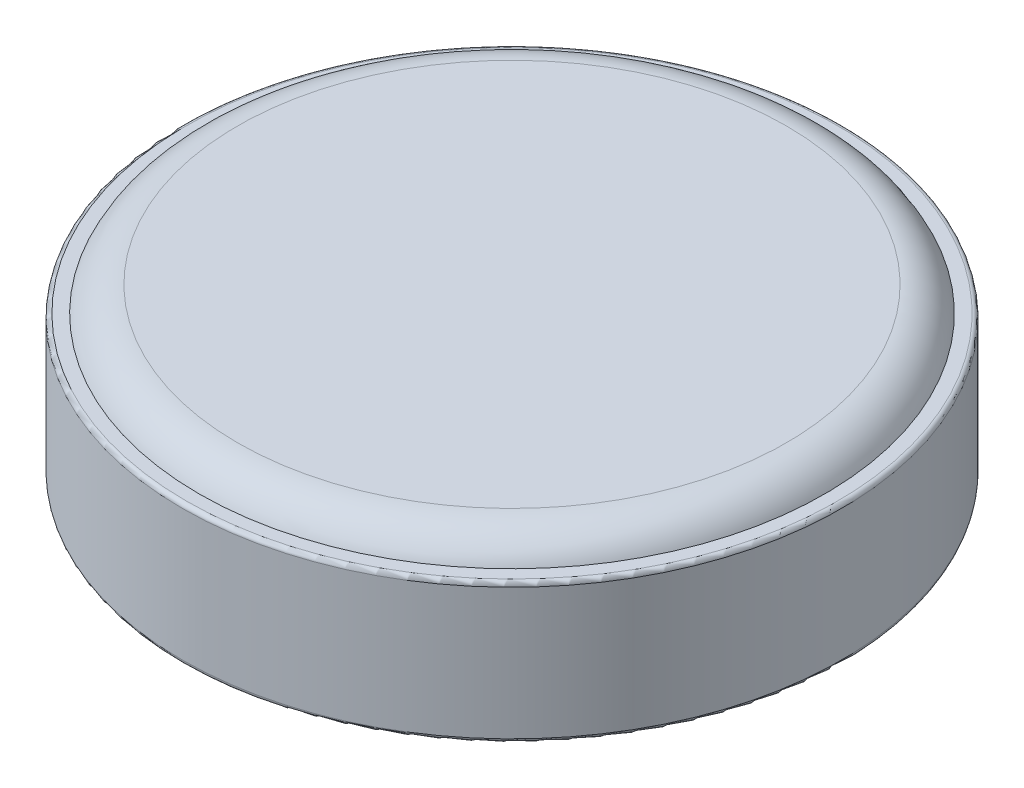
from build123d import *

# Parameters (mm, degrees)
SKETCH1_R           = 10
BOSS_EXTRUDE1_DEPTH = 5
CUT_EXTRUDE1_START  = -0.762
SKETCH2_R           = 10
SKETCH2_R_2         = 9.492
CUT_EXTRUDE1_DEPTH  = 0.762
FILLET3_R           = 1.27
FILLET2_R           = 0.127


with BuildPart() as part:
    # Sketch1 → Boss-Extrude1 (new body)
    with BuildSketch(Plane(origin=(0, 0, 0), x_dir=(1, 0, 0), z_dir=(0, 1, 0))):
        with Locations(Location((0, 0, 0), (0, 0, 270))):
            Circle(SKETCH1_R)
    extrude(amount=BOSS_EXTRUDE1_DEPTH)

    # Sketch2 → Cut-Extrude1 (cut)
    with BuildSketch(Plane(origin=(0, 5, 0), x_dir=(1, 0, 0), z_dir=(0, 1, 0)).offset(CUT_EXTRUDE1_START)):
        with Locations(Location((0, 0, 0), (0, 0, 270))):
            Circle(SKETCH2_R)
        with Locations(Location((0, 0, 0), (0, 0, 270))):
            Circle(SKETCH2_R_2, mode=Mode.SUBTRACT)
    extrude(amount=CUT_EXTRUDE1_DEPTH, mode=Mode.SUBTRACT)

    # Fillet3
    # the kernel refuses this fillet: 1.27 mm, written as the material it takes off along each edge
    with BuildSketch(Plane(origin=(0, 5, 0), x_dir=(0, 0, 1), z_dir=(-1, 0, 0))) as fillet3_piece_1:
        with BuildLine():
            CenterArc((8.328025773, -1.27), FILLET3_R, 23.578178478, 66.421821522)
            Line((8.328025773, 0), (8.328025773, 0.0254))
            Line((8.328025773, 0.0254), (9.492, 0.0254))
            Line((9.492, 0.0254), (9.5174, 0))
            ThreePointArc((9.5174, 0), (9.5174, -0.381), (9.515279485, -0.75184))
            Line((9.515279485, -0.75184), (9.492, -0.762))
        make_face()
    revolve(axis=Axis((0, 5, 0), (0, 1, 0)), mode=Mode.SUBTRACT)

    # Fillet2
    fillet2_edges = [part.edges().sort_by_distance(p)[0] for p in [
        (0, 0, -10),
        (0, 4.238, -10),
    ]]
    fillet(fillet2_edges, radius=FILLET2_R)


solid = part.part
